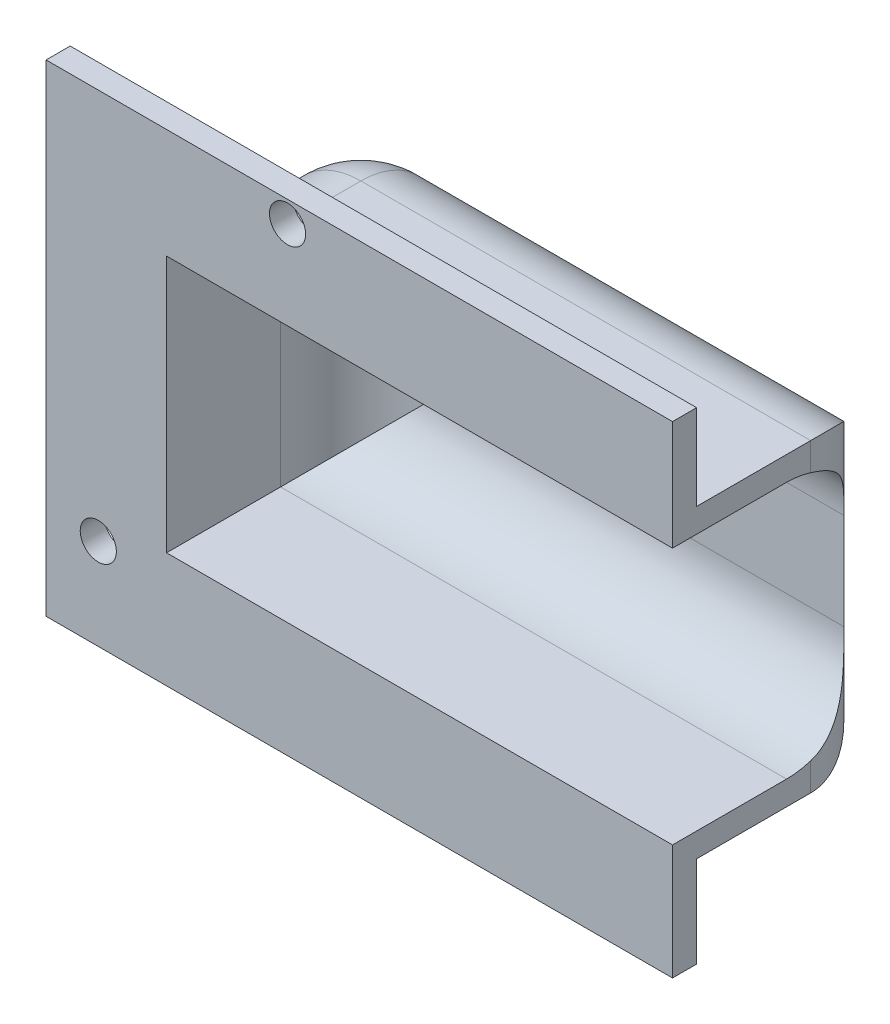
from build123d import *

# Parameters (mm, degrees)
SKETCH1_W           = 32
SKETCH1_H           = 60
BOSS_EXTRUDE1_DEPTH = 24.2
SHELL1_T            = 3
SKETCH3_W           = 3
SKETCH3_H           = 32
CUT_EXTRUDE1_DEPTH  = 24.2
BOSS_EXTRUDE2_START = 24.2
SKETCH4_W           = 60
SKETCH4_H           = 78
BOSS_EXTRUDE2_DEPTH = 3
CUT_EXTRUDE2_DEPTH  = 3
SKETCH6_R           = 2.25
CUT_EXTRUDE3_DEPTH  = 3
FILLET2_R           = 10
FILLET3_R           = 10
FILLET4_R           = 10


with BuildPart() as part:
    # Sketch1 → Boss-Extrude1 (new body)
    with BuildSketch(Plane(origin=(0, 0, 0), x_dir=(0, 1, 0), z_dir=(0, 0, 1))):
        Rectangle(SKETCH1_W, SKETCH1_H)
    extrude(amount=BOSS_EXTRUDE1_DEPTH)

    # Shell1
    shell1_openings = [part.faces().sort_by_distance(p)[0] for p in [
        (0, 0, 24.2),
    ]]
    offset(amount=SHELL1_T, openings=shell1_openings, kind=Kind.INTERSECTION)

    # Sketch3 → Cut-Extrude1 (cut)
    with BuildSketch(Plane.XY.offset(24.2)):
        with Locations((31.5, 0)):
            Rectangle(SKETCH3_W, SKETCH3_H)
    extrude(amount=-CUT_EXTRUDE1_DEPTH, mode=Mode.SUBTRACT)

    # Sketch4 → Boss-Extrude2 (add)
    with BuildSketch(Plane(origin=(0, 0, 0), x_dir=(0, 1, 0), z_dir=(0, 0, 1)).offset(BOSS_EXTRUDE2_START)):
        with Locations((-0.351117191, 6)):
            Rectangle(SKETCH4_W, SKETCH4_H)
    extrude(amount=-BOSS_EXTRUDE2_DEPTH)

    # Sketch5 → Cut-Extrude2 (cut)
    with BuildSketch(Plane.XY.offset(24.2)):
        Polygon((-30, -16), (30, -16), (33, -16), (33, -32.34351268), (43.583685091, -32.34351268), (43.583685091, 31.729117596), (33, 31.729117596), (33, 16), (30, 16), (-30, 16), align=None)
    extrude(amount=-CUT_EXTRUDE2_DEPTH, mode=Mode.SUBTRACT)

    # Sketch6 → Cut-Extrude3 (cut)
    with BuildSketch(Plane(origin=(0, 0, 21.2), x_dir=(1, 0, 0), z_dir=(0, 0, -1))):
        with Locations(Location((-14.936067977, -27, 0), (0, 0, 180))):
            Circle(SKETCH6_R)
        with Locations(Location((-38.5, 19, 0), (0, 0, 180))):
            Circle(SKETCH6_R)
    extrude(amount=-CUT_EXTRUDE3_DEPTH, mode=Mode.SUBTRACT)

    # Fillet2
    # the kernel refuses this fillet: 10 mm, written as the material it takes off along each edge
    with BuildSketch(Plane(origin=(-33, 44, -3), x_dir=(1, 0, 0), z_dir=(0, -1, 0))) as fillet2_piece_1:
        with BuildLine():
            CenterArc((FILLET2_R, FILLET2_R), FILLET2_R, 180, 90)
            Line((0, FILLET2_R), (0, 0))
            Line((0, 0), (FILLET2_R, 0))
        make_face()
    extrude(amount=88, mode=Mode.SUBTRACT)
    with BuildSketch(Plane(origin=(-58, -19, -3), x_dir=(0, 0, 1), z_dir=(1, 0, 0)), Plane(origin=(58, 19, -3), x_dir=(0, 0, 1), z_dir=(-1, 0, 0))) as fillet2_piece_2:
        with BuildLine():
            CenterArc((FILLET2_R, -FILLET2_R), FILLET2_R, 90, 90)
            Line((0, -FILLET2_R), (0, 0))
            Line((0, 0), (FILLET2_R, 0))
        make_face()
    extrude(amount=116, mode=Mode.SUBTRACT)
    with BuildSketch(Plane(origin=(33, -44, -3), x_dir=(0, 0, 1), z_dir=(0, 1, 0))) as fillet2_piece_3:
        with BuildLine():
            CenterArc((FILLET2_R, -FILLET2_R), FILLET2_R, 90, 90)
            Line((0, -FILLET2_R), (0, 0))
            Line((0, 0), (FILLET2_R, 0))
        make_face()
    extrude(amount=88, mode=Mode.SUBTRACT)

    # Fillet3
    fillet3_edges = [part.edges().sort_by_distance(p)[0] for p in [
        (0.070714214, 16, 0),
        (-30, 0, 0),
        (0.070714214, -16, 0),
    ]]
    fillet(fillet3_edges, radius=FILLET3_R)

    # Fillet4
    # the kernel refuses this fillet: 10 mm, written as the material it takes off along each edge
    with BuildSketch(Plane(origin=(-23, 9, 7), x_dir=(0, 1, 0), z_dir=(-1, 0, 0))) as fillet4_piece_1_section:
        Polygon((0, 0), (FILLET4_R * 1.02, 0), (FILLET4_R * 1.02, FILLET4_R * 1.02), (0, FILLET4_R * 1.02), align=None)
    fillet4_piece_1 = extrude(amount=FILLET4_R * 1.02, mode=Mode.PRIVATE)
    fillet4_piece_1 = fillet4_piece_1 - Plane(origin=(-23, 9, 7), x_dir=(0, -0.7071067811865475, 0.7071067811865475), z_dir=(-1, 0, 0)) * Sphere(FILLET4_R, mode=Mode.PRIVATE)
    add(fillet4_piece_1, mode=Mode.SUBTRACT)
    with BuildSketch(Plane(origin=(-23, -9, 7), x_dir=(-1, 0, 0), z_dir=(0, -1, 0))) as fillet4_piece_2_section:
        Polygon((0, 0), (FILLET4_R * 1.02, 0), (FILLET4_R * 1.02, FILLET4_R * 1.02), (0, FILLET4_R * 1.02), align=None)
    fillet4_piece_2 = extrude(amount=FILLET4_R * 1.02, mode=Mode.PRIVATE)
    fillet4_piece_2 = fillet4_piece_2 - Plane(origin=(-23, -9, 7), x_dir=(0.7071067811865475, 0, 0.7071067811865475), z_dir=(0, -1, 0)) * Sphere(FILLET4_R, mode=Mode.PRIVATE)
    add(fillet4_piece_2, mode=Mode.SUBTRACT)
    with BuildSketch(Plane(origin=(-33, -19, 7), x_dir=(1, 0, 0), z_dir=(0, 0, 1)), Plane(origin=(-33, 19, 7), x_dir=(0, -1, 0), z_dir=(0, 0, 1))) as fillet4_piece_3:
        with BuildLine():
            CenterArc((FILLET4_R, FILLET4_R), FILLET4_R, 180, 90)
            Line((0, FILLET4_R), (0, 0))
            Line((0, 0), (FILLET4_R, 0))
        make_face()
    extrude(amount=14.2, mode=Mode.SUBTRACT)


solid = part.part
